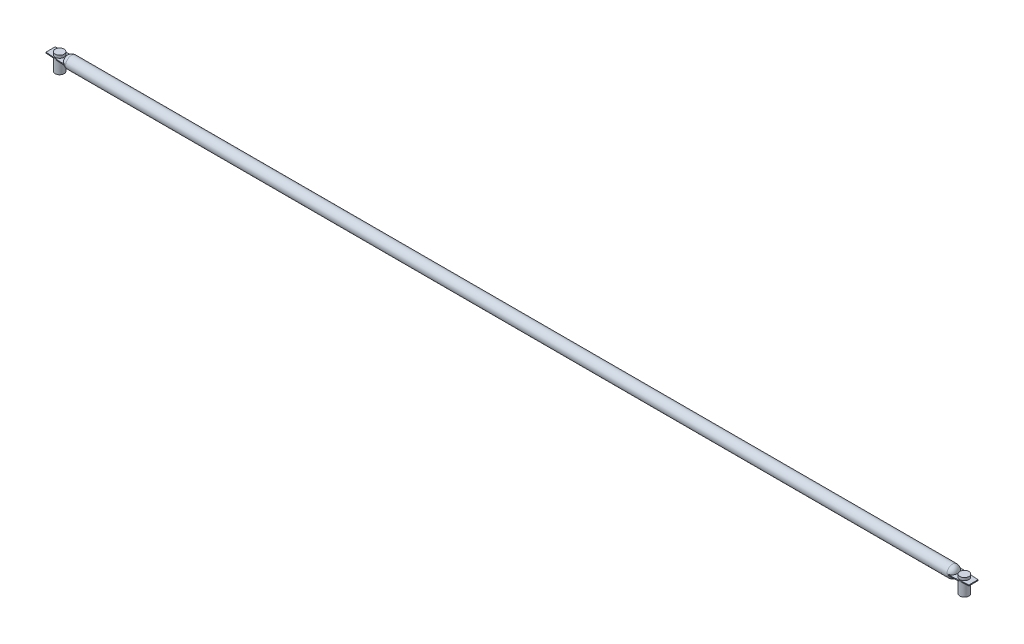
from build123d import *

# Parameters (mm, degrees)
EXTRUSION1_DEPTH      = 0.635
EXTRUSION1_DEPTH_BACK = 0.635
SKETCH1_R             = 6.35
EXTRUSION2_DEPTH      = 19.05
EXTRUSION2_DEPTH_BACK = 19.05
SKETCH2_R             = 6.35
SKETCH3_R             = 6.35
EXTRUSION3_DEPTH      = 13.97
SKETCH4_R             = 6.35
EXTRUSION4_DEPTH      = 3.81
SKETCH5_R             = 8.3312
EXTRUSION5_DEPTH      = 1271.27
SKETCH6_R             = 6.35
EXTRUSION6_DEPTH      = 1.27
SKETCH7_R             = 6.35
EXTRUSION7_DEPTH      = 20.32
FILLET1_R             = 7.62


with BuildPart() as part:
    # Sketch1 → Extrusion1 (new, two sides: drawn at the far end of the back side and taken through both)
    with BuildSketch(Plane(origin=(0, 0, 0), x_dir=(-1, 0, 0), z_dir=(0, 1, 0)).offset(-EXTRUSION1_DEPTH_BACK)):
        Polygon((-22.104096049, 6.444983804), (-22.104096049, -6.444983804), (0, -8.3312), (0, 8.3312), align=None)
        with Locations(Location((-9.144, 0, 0), (0, 0, 90))):
            Circle(SKETCH1_R, mode=Mode.SUBTRACT)
    extrude(amount=EXTRUSION1_DEPTH + EXTRUSION1_DEPTH_BACK)

    # Sketch2 → Extrusion2 (add, two sides: drawn at the far end of the back side and taken through both)
    with BuildSketch(Plane.XZ.offset(0.635).offset(-EXTRUSION2_DEPTH_BACK)):
        with Locations(Location((9.144, 0, 0), (0, 0, 270))):
            Circle(SKETCH2_R)
    extrude(amount=EXTRUSION2_DEPTH + EXTRUSION2_DEPTH_BACK)

    # Sketch3 → Extrusion3 (cut)
    with BuildSketch(Plane(origin=(0, 18.415, 0), x_dir=(-1, 0, 0), z_dir=(0, 1, 0))):
        with Locations(Location((-9.144, 0, 0), (0, 0, 270))):
            Circle(SKETCH3_R)
    extrude(amount=-EXTRUSION3_DEPTH, mode=Mode.SUBTRACT)

    # Sketch5 → Extrusion5 (add)
    with BuildSketch(Plane.ZY):
        Circle(SKETCH5_R)
    extrude(amount=EXTRUSION5_DEPTH)

    # Sketch6 → Extrusion6 (add)
    with BuildSketch(Plane.XZ.offset(-0.635)):
        Polygon((-1293.4696, 0), (-1293.4696, -6.477), (-1271.27, -8.3312), (-1271.27, 8.3312), (-1293.4696, 6.477), align=None)
        with Locations(Location((-1280.5156, 0, 0), (0, 0, 90))):
            Circle(SKETCH6_R, mode=Mode.SUBTRACT)
    extrude(amount=EXTRUSION6_DEPTH)



with BuildPart() as body_2:
    # Sketch4 → Extrusion4 (new body)
    with BuildSketch(Plane(origin=(0, 4.445, 0), x_dir=(-1, 0, 0), z_dir=(0, 1, 0))):
        with Locations(Location((1280.5156, 0, 0), (0, 0, 90))):
            Circle(SKETCH4_R)
    extrude(amount=-EXTRUSION4_DEPTH)


with BuildPart() as part_1:
    add(part.part)

    add(body_2.part)  # Extrusion7 merges body 2
    # Sketch7 → Extrusion7 (add)
    with BuildSketch(Plane.XZ.offset(-0.635)):
        with Locations(Location((-1280.5156, 0, 0), (0, 0, 270))):
            Circle(SKETCH7_R)
    extrude(amount=EXTRUSION7_DEPTH)

    # Fillet1
    # the kernel refuses this fillet: 7.62 mm, written as the material it takes off along each edge
    with BuildSketch(Plane(origin=(-1271.27, 0, 0), x_dir=(0, -0.9999950652018581, 0.003141587485873656), z_dir=(0, -0.003141587485873656, -0.9999950652018581))) as fillet1_piece_1_section:
        with BuildLine():
            CenterArc((8.3312 - FILLET1_R, -FILLET1_R), FILLET1_R, 0, 90)
            Line((8.3312 - FILLET1_R, 0), (8.3312, 0))
            Line((8.3312, 0), (8.3312, -FILLET1_R))
        make_face()
    fillet1_piece_1 = revolve(axis=Axis((-1271.27, 0, 0), (-1, 0, 0)), revolution_arc=359.64, mode=Mode.PRIVATE)
    fillet1_piece_1 = split(fillet1_piece_1, bisect_by=Plane(origin=(-1269.374883086, -0.635, 4.28224122), z_dir=(0, -1, 0)), keep=Keep.TOP, mode=Mode.PRIVATE)
    add(fillet1_piece_1, mode=Mode.SUBTRACT)
    with BuildSketch(Plane(origin=(-1271.27, 0, 0), x_dir=(0, -0.9999950652018581, 0.003141587485873656), z_dir=(0, -0.003141587485873656, -0.9999950652018581))) as fillet1_piece_2_section:
        with BuildLine():
            CenterArc((8.3312 - FILLET1_R, -FILLET1_R), FILLET1_R, 0, 90)
            Line((8.3312 - FILLET1_R, 0), (8.3312, 0))
            Line((8.3312, 0), (8.3312, -FILLET1_R))
        make_face()
    fillet1_piece_2 = revolve(axis=Axis((-1271.27, 0, 0), (-1, 0, 0)), revolution_arc=359.64, mode=Mode.PRIVATE)
    fillet1_piece_2 = split(fillet1_piece_2, bisect_by=Plane(origin=(-1269.082318262, 0.635, 0), z_dir=(0, 1, 0)), keep=Keep.TOP, mode=Mode.PRIVATE)
    add(fillet1_piece_2, mode=Mode.SUBTRACT)
    with BuildSketch(Plane(origin=(0, 0, 0), x_dir=(0, -0.9999950652018581, 0.003141587485874322), z_dir=(0, -0.003141587485874322, -0.9999950652018581))) as fillet1_piece_3_section:
        with BuildLine():
            CenterArc((8.3312 - FILLET1_R, FILLET1_R), FILLET1_R, 270, 90)
            Line((8.3312, FILLET1_R), (8.3312, 0))
            Line((8.3312, 0), (8.3312 - FILLET1_R, 0))
        make_face()
    fillet1_piece_3 = revolve(axis=Axis((0, 0, 0), (-1, 0, 0)), revolution_arc=359.64, mode=Mode.PRIVATE)
    fillet1_piece_3 = split(fillet1_piece_3, bisect_by=Plane(origin=(-1.895117191, -0.635, 4.282241186), z_dir=(0, -1, 0)), keep=Keep.TOP, mode=Mode.PRIVATE)
    add(fillet1_piece_3, mode=Mode.SUBTRACT)
    with BuildSketch(Plane(origin=(0, 0, 0), x_dir=(0, -0.9999950652018581, 0.003141587485874322), z_dir=(0, -0.003141587485874322, -0.9999950652018581))) as fillet1_piece_4_section:
        with BuildLine():
            CenterArc((8.3312 - FILLET1_R, FILLET1_R), FILLET1_R, 270, 90)
            Line((8.3312, FILLET1_R), (8.3312, 0))
            Line((8.3312, 0), (8.3312 - FILLET1_R, 0))
        make_face()
    fillet1_piece_4 = revolve(axis=Axis((0, 0, 0), (-1, 0, 0)), revolution_arc=359.64, mode=Mode.PRIVATE)
    fillet1_piece_4 = split(fillet1_piece_4, bisect_by=Plane(origin=(-2.187681733, 0.635, 0), z_dir=(0, 1, 0)), keep=Keep.TOP, mode=Mode.PRIVATE)
    add(fillet1_piece_4, mode=Mode.SUBTRACT)
    with BuildSketch(Plane(origin=(0, 0, 0), x_dir=(0, 0.9999950652018581, -0.00314158748588508), z_dir=(0, 0.00314158748588508, 0.9999950652018581))) as fillet1_piece_5_section:
        with BuildLine():
            CenterArc((8.3312 - FILLET1_R, FILLET1_R), FILLET1_R, 270, 90)
            Line((8.3312, FILLET1_R), (8.3312, 0))
            Line((8.3312, 0), (8.3312 - FILLET1_R, 0))
        make_face()
    fillet1_piece_5 = revolve(axis=Axis((0, 0, 0), (-1, 0, 0)), revolution_arc=359.64, mode=Mode.PRIVATE)
    fillet1_piece_5 = split(fillet1_piece_5, bisect_by=Plane(origin=(-1.895117191, 0.635, -4.282241186), z_dir=(0, 1, 0)), keep=Keep.TOP, mode=Mode.PRIVATE)
    add(fillet1_piece_5, mode=Mode.SUBTRACT)
    with BuildSketch(Plane(origin=(0, 0, 0), x_dir=(0, 0.9999950652018581, -0.00314158748588508), z_dir=(0, 0.00314158748588508, 0.9999950652018581))) as fillet1_piece_6_section:
        with BuildLine():
            CenterArc((8.3312 - FILLET1_R, FILLET1_R), FILLET1_R, 270, 90)
            Line((8.3312, FILLET1_R), (8.3312, 0))
            Line((8.3312, 0), (8.3312 - FILLET1_R, 0))
        make_face()
    fillet1_piece_6 = revolve(axis=Axis((0, 0, 0), (-1, 0, 0)), revolution_arc=359.64, mode=Mode.PRIVATE)
    fillet1_piece_6 = split(fillet1_piece_6, bisect_by=Plane(origin=(-2.187681733, -0.635, 0), z_dir=(0, -1, 0)), keep=Keep.TOP, mode=Mode.PRIVATE)
    add(fillet1_piece_6, mode=Mode.SUBTRACT)
    with BuildSketch(Plane(origin=(-1271.27, 0, 0), x_dir=(0, 0.9999950652018581, -0.003141587485884858), z_dir=(0, 0.003141587485884858, 0.9999950652018581))) as fillet1_piece_7_section:
        with BuildLine():
            CenterArc((8.3312 - FILLET1_R, -FILLET1_R), FILLET1_R, 0, 90)
            Line((8.3312 - FILLET1_R, 0), (8.3312, 0))
            Line((8.3312, 0), (8.3312, -FILLET1_R))
        make_face()
    fillet1_piece_7 = revolve(axis=Axis((-1271.27, 0, 0), (-1, 0, 0)), revolution_arc=359.64, mode=Mode.PRIVATE)
    fillet1_piece_7 = split(fillet1_piece_7, bisect_by=Plane(origin=(-1269.374883188, 0.635, -4.282241233), z_dir=(0, 1, 0)), keep=Keep.TOP, mode=Mode.PRIVATE)
    add(fillet1_piece_7, mode=Mode.SUBTRACT)
    with BuildSketch(Plane(origin=(-1271.27, 0, 0), x_dir=(0, 0.9999950652018581, -0.003141587485884858), z_dir=(0, 0.003141587485884858, 0.9999950652018581))) as fillet1_piece_8_section:
        with BuildLine():
            CenterArc((8.3312 - FILLET1_R, -FILLET1_R), FILLET1_R, 0, 90)
            Line((8.3312 - FILLET1_R, 0), (8.3312, 0))
            Line((8.3312, 0), (8.3312, -FILLET1_R))
        make_face()
    fillet1_piece_8 = revolve(axis=Axis((-1271.27, 0, 0), (-1, 0, 0)), revolution_arc=359.64, mode=Mode.PRIVATE)
    fillet1_piece_8 = split(fillet1_piece_8, bisect_by=Plane(origin=(-1269.082318263, -0.635, 0), z_dir=(0, -1, 0)), keep=Keep.TOP, mode=Mode.PRIVATE)
    add(fillet1_piece_8, mode=Mode.SUBTRACT)


solid = part_1.part
